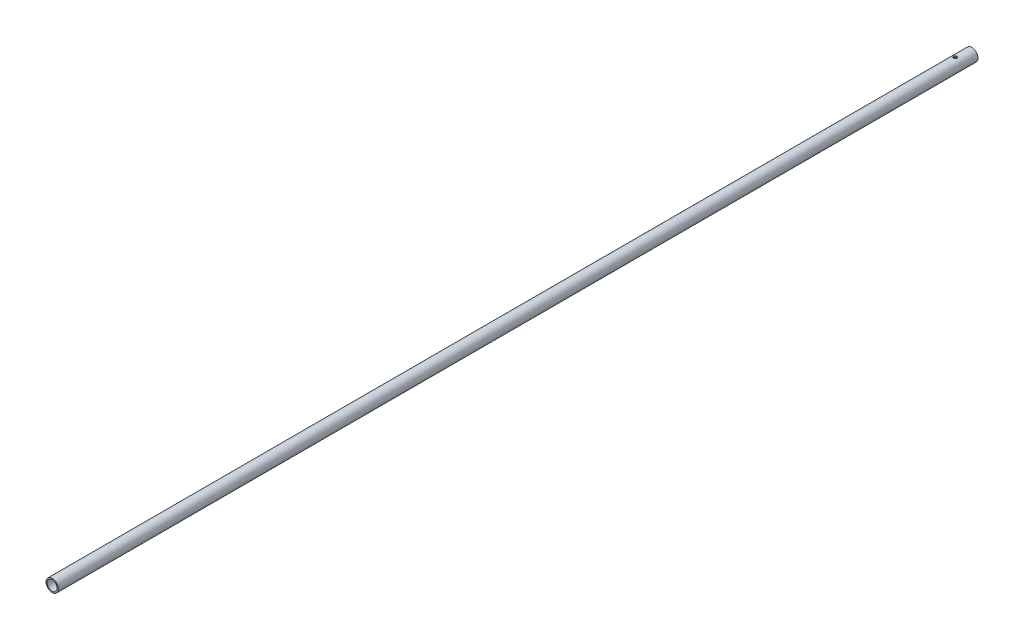
from build123d import *

# Parameters (mm, degrees)
SKETCH1_R                           = 3.7592
SKETCH1_R_2                         = 3.048
BOSS_EXTRUDE1_DEPTH                 = 558.8
CUT_EXTRUDE1_REACH                  = 560.825
CUT_EXTRUDE1_END_RADIUS             = 3.7592
SKETCH2_R                           = 1.016
CUT_EXTRUDE1_DIRECTION_2_REACH      = 560.825
CUT_EXTRUDE1_DIRECTION_2_END_RADIUS = 3.7592


with BuildPart() as part:
    # Sketch1 → Boss-Extrude1 (new body)
    with BuildSketch(Plane.XY):
        Circle(SKETCH1_R)
        Circle(SKETCH1_R_2, mode=Mode.SUBTRACT)
    extrude(amount=BOSS_EXTRUDE1_DEPTH)

    # Cut-Extrude1: up to this cylinder (the profile starts inside it)
    cut_extrude1_end = Plane(origin=(0, 0, 10.16), z_dir=(0, 0, -1)) * Cylinder(CUT_EXTRUDE1_END_RADIUS, 1130.1684, mode=Mode.PRIVATE)
    # Sketch2 → Cut-Extrude1 (cut, up to the surface)
    with BuildSketch(Plane(origin=(0, 0, 0), x_dir=(1, 0, 0), z_dir=(0, 1, 0)), mode=Mode.PRIVATE) as cut_extrude1_sk1:
        with Locations((0, -10.16)):
            Circle(SKETCH2_R)
    cut_extrude1_tool1 = extrude(cut_extrude1_sk1.sketch, amount=-CUT_EXTRUDE1_REACH, mode=Mode.PRIVATE) & cut_extrude1_end
    add(cut_extrude1_tool1.solids().sort_by_distance((0, 0, 10.16))[0], mode=Mode.SUBTRACT)

    # Cut-Extrude1 direction 2: up to this cylinder (the profile starts inside it)
    cut_extrude1_direction_2_end = Plane(origin=(0, 0, 10.16), z_dir=(0, 0, -1)) * Cylinder(CUT_EXTRUDE1_DIRECTION_2_END_RADIUS, 1130.1684, mode=Mode.PRIVATE)
    # Sketch2 → Cut-Extrude1 direction 2 (cut, up to the surface)
    with BuildSketch(Plane(origin=(0, 0, 0), x_dir=(1, 0, 0), z_dir=(0, 1, 0)), mode=Mode.PRIVATE) as cut_extrude1_direction_2_sk1:
        with Locations((0, -10.16)):
            Circle(SKETCH2_R)
    cut_extrude1_direction_2_tool1 = extrude(cut_extrude1_direction_2_sk1.sketch, amount=CUT_EXTRUDE1_DIRECTION_2_REACH, mode=Mode.PRIVATE) & cut_extrude1_direction_2_end
    add(cut_extrude1_direction_2_tool1.solids().sort_by_distance((0, 0, 10.16))[0], mode=Mode.SUBTRACT)


solid = part.part
